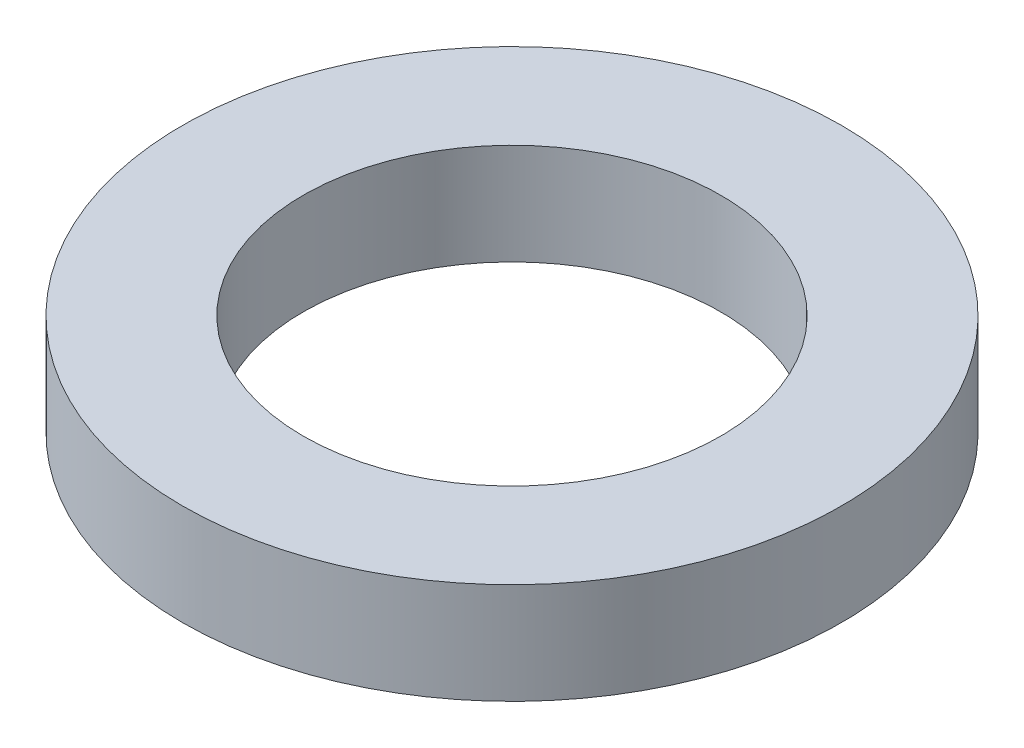
from build123d import *

# Parameters (mm, degrees)
SKETCH1_R           = 75
BOSS_EXTRUDE1_DEPTH = 23
SKETCH2_R           = 47.5
CUT_EXTRUDE1_DEPTH  = 109.531101533


with BuildPart() as part:
    # Sketch1 → Boss-Extrude1 (new body)
    with BuildSketch(Plane(origin=(0, 0, 0), x_dir=(1, 0, 0), z_dir=(0, 1, 0))):
        Circle(SKETCH1_R)
    extrude(amount=BOSS_EXTRUDE1_DEPTH)

    # Sketch2 → Cut-Extrude1 (cut, through all)
    with BuildSketch(Plane(origin=(0, 0, 0), x_dir=(1, 0, 0), z_dir=(0, 1, 0))):
        Circle(SKETCH2_R)
    extrude(amount=CUT_EXTRUDE1_DEPTH, mode=Mode.SUBTRACT)


solid = part.part
